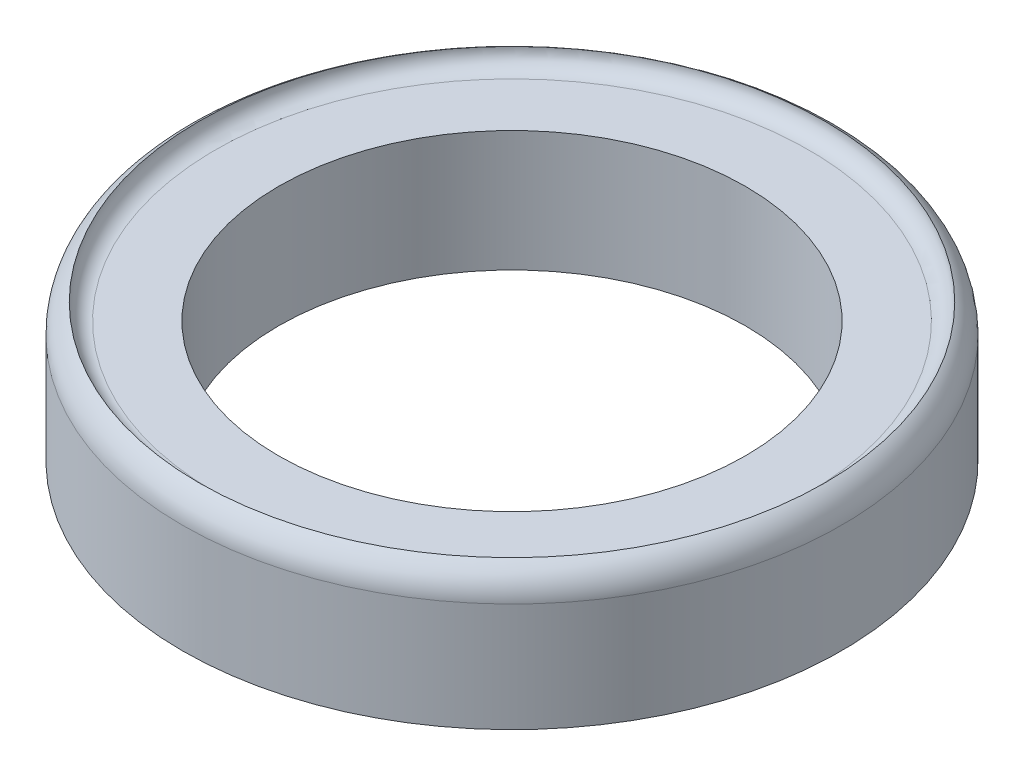
from build123d import *

# Parameters (mm, degrees)
SKETCH1_R           = 22.8
SKETCH1_R_2         = 17
BOSS_EXTRUDE4_DEPTH = 8.8
BOSS_EXTRUDE6_DEPTH = 10
FILLET1_R           = 1.2
FILLET2_R           = 2.4


# Some blends are built 0.0001 mm under size
with BuildPart() as part:
    # Sketch1 → Boss-Extrude4 (new body)
    with BuildSketch(Plane(origin=(0, 0, 0), x_dir=(1, 0, 0), z_dir=(0, 1, 0))):
        with Locations(Location((0, 0, 0), (0, 0, 270))):
            Circle(SKETCH1_R)
        with Locations(Location((0, 0, 0), (0, 0, 270))):
            Circle(SKETCH1_R_2, mode=Mode.SUBTRACT)
    extrude(amount=BOSS_EXTRUDE4_DEPTH)

    # Sketch1<7> → Boss-Extrude6 (add)
    with BuildSketch(Plane(origin=(0, 0, 0), x_dir=(1, 0, 0), z_dir=(0, 1, 0))):
        with BuildLine():
            ThreePointArc((24, 0), (0, 24), (-24, 0))
            Line((-24, 0), (-22.8, 0))
            ThreePointArc((-22.8, 0), (0, 22.8), (22.8, 0))
            Line((22.8, 0), (24, 0))
        make_face()
        with BuildLine():
            Line((-22.8, 0), (-24, 0))
            ThreePointArc((-24, 0), (0, -24), (24, 0))
            Line((24, 0), (22.8, 0))
            ThreePointArc((22.8, 0), (0, -22.8), (-22.8, 0))
        make_face()
    extrude(amount=BOSS_EXTRUDE6_DEPTH)

    # Fillet1
    fillet1_edges = [part.edges().sort_by_distance(p)[0] for p in [
        (-22.8, 8.8, 0),
    ]]
    fillet(fillet1_edges, radius=FILLET1_R - 0.0001)  # a hair under: the kernel refuses the full size

    # Fillet2
    # the kernel refuses this fillet: 2.4 mm, written as the material it takes off along each edge
    with BuildSketch(Plane(origin=(0, 10, 0), x_dir=(1, 0, 0), z_dir=(0, 0, 1))) as fillet2_piece_1:
        with BuildLine():
            CenterArc((21.6, -2.078460969), FILLET2_R, 0, 60)
            Line((24, -2.078460969), (24.048, -2.078460969))
            Line((24.048, -2.078460969), (24.048, 0))
            Line((24.048, 0), (24, 0.048))
            ThreePointArc((24, 0.048), (23.4, 0.048), (22.824, 0.041569219))
            Line((22.824, 0.041569219), (22.8, 0))
        make_face()
    revolve(axis=Axis((0, 10, 0), (0, 1, 0)), mode=Mode.SUBTRACT)


solid = part.part
